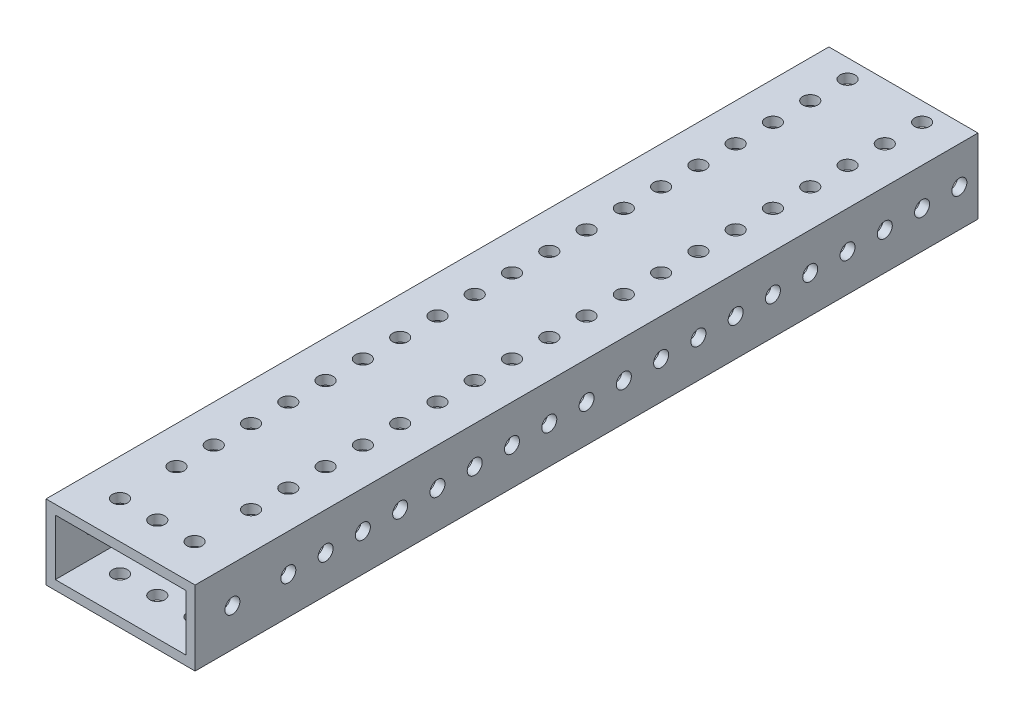
from build123d import *

# Parameters (mm, degrees)
SKETCH1_W           = 50.8
SKETCH1_H           = 266.7
BOSS_EXTRUDE1_DEPTH = 25.4
SKETCH2_W           = 44.45
SKETCH2_H           = 19.05
CUT_EXTRUDE1_DEPTH  = 273.680564031
SKETCH4_R           = 2.5527
CUT_EXTRUDE2_DEPTH  = 273.680564031
SKETCH5_R           = 2.5527
CUT_EXTRUDE3_DEPTH  = 273.680564031


with BuildPart() as part:
    # Sketch1 → Boss-Extrude1 (new body)
    with BuildSketch(Plane(origin=(0, 0, 0), x_dir=(1, 0, 0), z_dir=(0, 1, 0))):
        with Locations((25.4, 133.35)):
            Rectangle(SKETCH1_W, SKETCH1_H)
    extrude(amount=BOSS_EXTRUDE1_DEPTH)

    # Sketch2 → Cut-Extrude1 (cut, through all)
    with BuildSketch(Plane.XY):
        with Locations((25.4, 12.7)):
            Rectangle(SKETCH2_W, SKETCH2_H)
    extrude(amount=-CUT_EXTRUDE1_DEPTH, mode=Mode.SUBTRACT)

    # Sketch4 → Cut-Extrude2 (cut, through all)
    with BuildSketch(Plane(origin=(0, 25.4, 0), x_dir=(1, 0, 0), z_dir=(0, 1, 0))):
        with Locations((12.7, 31.75)):
            Circle(SKETCH4_R)
        with Locations((38.1, 31.75)):
            Circle(SKETCH4_R)
        with Locations((12.7, 44.45)):
            Circle(SKETCH4_R)
        with Locations((38.1, 44.45)):
            Circle(SKETCH4_R)
        with Locations((12.7, 57.15)):
            Circle(SKETCH4_R)
        with Locations((38.1, 57.15)):
            Circle(SKETCH4_R)
        with Locations((12.7, 69.85)):
            Circle(SKETCH4_R)
        with Locations((38.1, 69.85)):
            Circle(SKETCH4_R)
        with Locations((12.7, 82.55)):
            Circle(SKETCH4_R)
        with Locations((38.1, 82.55)):
            Circle(SKETCH4_R)
        with Locations((12.7, 95.25)):
            Circle(SKETCH4_R)
        with Locations((38.1, 95.25)):
            Circle(SKETCH4_R)
        with Locations((12.7, 107.95)):
            Circle(SKETCH4_R)
        with Locations((38.1, 107.95)):
            Circle(SKETCH4_R)
        with Locations((12.7, 120.65)):
            Circle(SKETCH4_R)
        with Locations((38.1, 120.65)):
            Circle(SKETCH4_R)
        with Locations((12.7, 133.35)):
            Circle(SKETCH4_R)
        with Locations((38.1, 133.35)):
            Circle(SKETCH4_R)
        with Locations((12.7, 146.05)):
            Circle(SKETCH4_R)
        with Locations((38.1, 146.05)):
            Circle(SKETCH4_R)
        with Locations((12.7, 158.75)):
            Circle(SKETCH4_R)
        with Locations((38.1, 158.75)):
            Circle(SKETCH4_R)
        with Locations((12.7, 171.45)):
            Circle(SKETCH4_R)
        with Locations((38.1, 171.45)):
            Circle(SKETCH4_R)
        with Locations((12.7, 184.15)):
            Circle(SKETCH4_R)
        with Locations((38.1, 184.15)):
            Circle(SKETCH4_R)
        with Locations((12.7, 196.85)):
            Circle(SKETCH4_R)
        with Locations((38.1, 196.85)):
            Circle(SKETCH4_R)
        with Locations((12.7, 209.55)):
            Circle(SKETCH4_R)
        with Locations((38.1, 209.55)):
            Circle(SKETCH4_R)
        with Locations((12.7, 222.25)):
            Circle(SKETCH4_R)
        with Locations((38.1, 222.25)):
            Circle(SKETCH4_R)
        with Locations((12.7, 234.95)):
            Circle(SKETCH4_R)
        with Locations((38.1, 234.95)):
            Circle(SKETCH4_R)
        with Locations((12.7, 247.65)):
            Circle(SKETCH4_R)
        with Locations((38.1, 247.65)):
            Circle(SKETCH4_R)
        with Locations((12.7, 260.35)):
            Circle(SKETCH4_R)
        with Locations((38.1, 260.35)):
            Circle(SKETCH4_R)
        with Locations((12.7, 273.05)):
            Circle(SKETCH4_R)
        with Locations((38.1, 273.05)):
            Circle(SKETCH4_R)
        with Locations((12.7, 285.75)):
            Circle(SKETCH4_R)
        with Locations((38.1, 285.75)):
            Circle(SKETCH4_R)
        with Locations((12.7, 298.45)):
            Circle(SKETCH4_R)
        with Locations((38.1, 298.45)):
            Circle(SKETCH4_R)
        with Locations((12.7, 311.15)):
            Circle(SKETCH4_R)
        with Locations((38.1, 311.15)):
            Circle(SKETCH4_R)
        with Locations((12.7, 323.85)):
            Circle(SKETCH4_R)
        with Locations((38.1, 323.85)):
            Circle(SKETCH4_R)
        with Locations((12.7, 336.55)):
            Circle(SKETCH4_R)
        with Locations((38.1, 336.55)):
            Circle(SKETCH4_R)
        with Locations((12.7, 349.25)):
            Circle(SKETCH4_R)
        with Locations((38.1, 349.25)):
            Circle(SKETCH4_R)
        with Locations((12.7, 361.95)):
            Circle(SKETCH4_R)
        with Locations((38.1, 361.95)):
            Circle(SKETCH4_R)
        with Locations((12.7, 374.65)):
            Circle(SKETCH4_R)
        with Locations((38.1, 374.65)):
            Circle(SKETCH4_R)
        with Locations((12.7, 387.35)):
            Circle(SKETCH4_R)
        with Locations((38.1, 387.35)):
            Circle(SKETCH4_R)
        with Locations((12.7, 400.05)):
            Circle(SKETCH4_R)
        with Locations((38.1, 400.05)):
            Circle(SKETCH4_R)
        with Locations((12.7, 412.75)):
            Circle(SKETCH4_R)
        with Locations((38.1, 412.75)):
            Circle(SKETCH4_R)
        with Locations((12.7, 425.45)):
            Circle(SKETCH4_R)
        with Locations((38.1, 425.45)):
            Circle(SKETCH4_R)
        with Locations((12.7, 438.15)):
            Circle(SKETCH4_R)
        with Locations((38.1, 438.15)):
            Circle(SKETCH4_R)
        with Locations((12.7, 450.85)):
            Circle(SKETCH4_R)
        with Locations((38.1, 450.85)):
            Circle(SKETCH4_R)
        with Locations((12.7, 463.55)):
            Circle(SKETCH4_R)
        with Locations((38.1, 463.55)):
            Circle(SKETCH4_R)
        with Locations((12.7, 476.25)):
            Circle(SKETCH4_R)
        with Locations((38.1, 476.25)):
            Circle(SKETCH4_R)
        with Locations((12.7, 488.95)):
            Circle(SKETCH4_R)
        with Locations((38.1, 488.95)):
            Circle(SKETCH4_R)
        with Locations((12.7, 501.65)):
            Circle(SKETCH4_R)
        with Locations((38.1, 501.65)):
            Circle(SKETCH4_R)
        with Locations((12.5095, 12.7)):
            Circle(SKETCH4_R)
        with Locations((25.2095, 12.7)):
            Circle(SKETCH4_R)
        with Locations((37.9095, 12.7)):
            Circle(SKETCH4_R)
    extrude(amount=-CUT_EXTRUDE2_DEPTH, mode=Mode.SUBTRACT)

    # Sketch5 → Cut-Extrude3 (cut, through all)
    with BuildSketch(Plane.ZY):
        with Locations((-31.75, 12.7)):
            Circle(SKETCH5_R)
        with Locations((-44.45, 12.7)):
            Circle(SKETCH5_R)
        with Locations((-57.15, 12.7)):
            Circle(SKETCH5_R)
        with Locations((-69.85, 12.7)):
            Circle(SKETCH5_R)
        with Locations((-82.55, 12.7)):
            Circle(SKETCH5_R)
        with Locations((-95.25, 12.7)):
            Circle(SKETCH5_R)
        with Locations((-107.95, 12.7)):
            Circle(SKETCH5_R)
        with Locations((-120.65, 12.7)):
            Circle(SKETCH5_R)
        with Locations((-133.35, 12.7)):
            Circle(SKETCH5_R)
        with Locations((-146.05, 12.7)):
            Circle(SKETCH5_R)
        with Locations((-158.75, 12.7)):
            Circle(SKETCH5_R)
        with Locations((-171.45, 12.7)):
            Circle(SKETCH5_R)
        with Locations((-184.15, 12.7)):
            Circle(SKETCH5_R)
        with Locations((-196.85, 12.7)):
            Circle(SKETCH5_R)
        with Locations((-209.55, 12.7)):
            Circle(SKETCH5_R)
        with Locations((-222.25, 12.7)):
            Circle(SKETCH5_R)
        with Locations((-234.95, 12.7)):
            Circle(SKETCH5_R)
        with Locations((-247.65, 12.7)):
            Circle(SKETCH5_R)
        with Locations((-260.35, 12.7)):
            Circle(SKETCH5_R)
        with Locations((-285.75, 12.7)):
            Circle(SKETCH5_R)
        with Locations((-298.45, 12.7)):
            Circle(SKETCH5_R)
        with Locations((-311.15, 12.7)):
            Circle(SKETCH5_R)
        with Locations((-323.85, 12.7)):
            Circle(SKETCH5_R)
        with Locations((-336.55, 12.7)):
            Circle(SKETCH5_R)
        with Locations((-349.25, 12.7)):
            Circle(SKETCH5_R)
        with Locations((-361.95, 12.7)):
            Circle(SKETCH5_R)
        with Locations((-374.65, 12.7)):
            Circle(SKETCH5_R)
        with Locations((-387.35, 12.7)):
            Circle(SKETCH5_R)
        with Locations((-400.05, 12.7)):
            Circle(SKETCH5_R)
        with Locations((-412.75, 12.7)):
            Circle(SKETCH5_R)
        with Locations((-425.45, 12.7)):
            Circle(SKETCH5_R)
        with Locations((-438.15, 12.7)):
            Circle(SKETCH5_R)
        with Locations((-450.85, 12.7)):
            Circle(SKETCH5_R)
        with Locations((-463.55, 12.7)):
            Circle(SKETCH5_R)
        with Locations((-476.25, 12.7)):
            Circle(SKETCH5_R)
        with Locations((-488.95, 12.7)):
            Circle(SKETCH5_R)
        with Locations((-501.65, 12.7)):
            Circle(SKETCH5_R)
        with Locations((-12.7, 12.954)):
            Circle(SKETCH5_R)
    extrude(amount=-CUT_EXTRUDE3_DEPTH, mode=Mode.SUBTRACT)


solid = part.part
